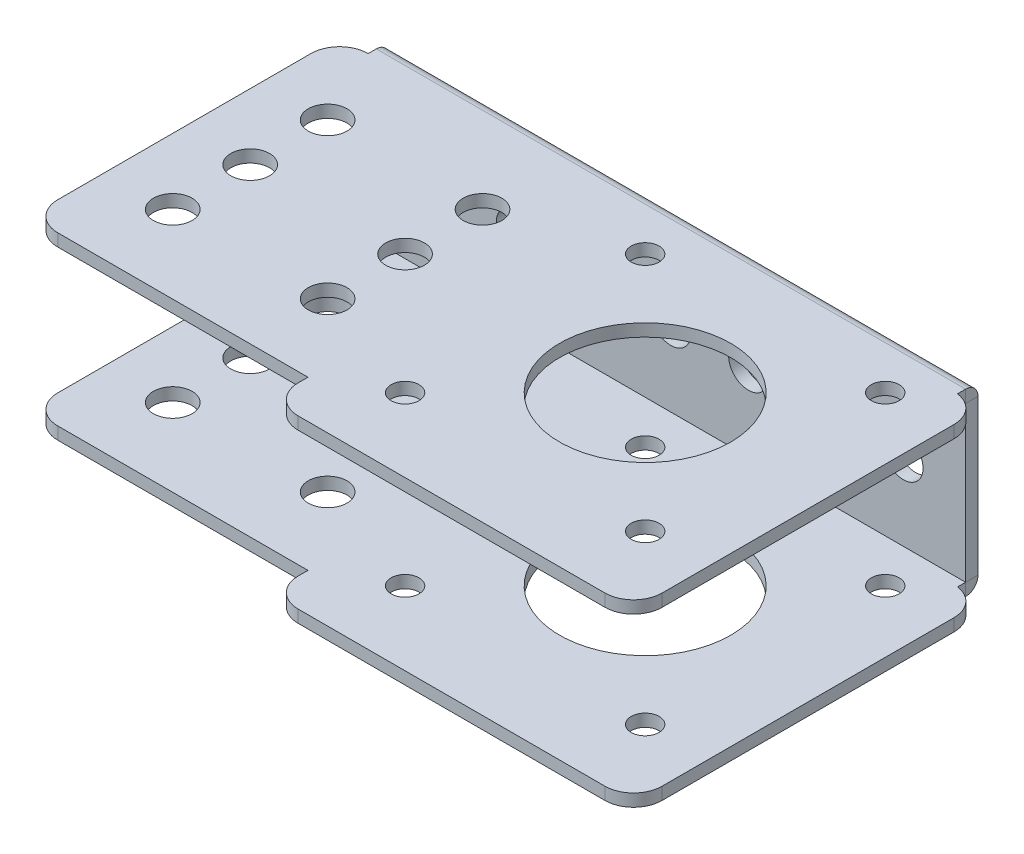
from build123d import *

# Parameters (mm, degrees)
SKETCH1_R                    = 2.5
SKETCH1_R_2                  = 1.8
SKETCH1_R_3                  = 2.55
SKETCH1_R_4                  = 11.05
BOSS_EXTRUDE1_DEPTH          = 1.6
SKETCHED_START               = -26.738102053
SKETCHED_BEND1_OUTLINE_W     = 83
SKETCHED_BEND1_OUTLINE_H     = 1.6
SKETCHED_BEND1_DEPTH         = 45.741537679
SKETCHED_START_2             = 42.203435626
SKETCHED_BEND1_2_OUTLINE_W   = 83
SKETCHED_BEND1_2_OUTLINE_H   = 1.6
SKETCHED_BEND1_2_DEPTH       = 45.741537678
SKETCHED_START_3             = 19.003435626
SKETCHED_BEND1_3_OUTLINE_R   = 2.5
SKETCHED_BEND1_3_OUTLINE_R_2 = 1.8
SKETCHED_BEND1_3_OUTLINE_R_3 = 11.05
SKETCHED_BEND1_3_DEPTH       = 1.6
SKETCHED_START_4             = 40.603435626
SKETCHED_BEND1_4_OUTLINE_R   = 2.5
SKETCHED_BEND1_4_OUTLINE_R_2 = 1.8
SKETCHED_BEND1_4_OUTLINE_R_3 = 11.05
SKETCHED_BEND1_4_DEPTH       = 1.6
SKETCHED_START_5             = -92
SKETCHED_BEND1_5_DEPTH       = 78


with BuildPart() as part:
    # Sketch1 → Boss-Extrude1 (new body)
    with BuildSketch(Plane.XY):
        with BuildLine():
            Line((-91.108168831, 42.903435626), (-91.108168831, 18.303435626))
            ThreePointArc((-91.108168831, 18.303435626), (-93.724463922, 17.219730716), (-94.808168831, 14.603435626))
            Line((-94.808168831, 14.603435626), (-94.808168831, -18.079639731))
            ThreePointArc((-94.808168831, -18.079639731), (-93.724463922, -20.695934821), (-91.108168831, -21.779639731))
            Line((-91.108168831, -21.779639731), (-58.808168831, -21.779639731))
            Line((-58.808168831, -21.779639731), (-58.808168831, -23.038102053))
            ThreePointArc((-58.808168831, -23.038102053), (-57.724463922, -25.654397143), (-55.108168831, -26.738102053))
            Line((-55.108168831, -26.738102053), (-15.508168831, -26.738102053))
            ThreePointArc((-15.508168831, -26.738102053), (-12.891873741, -25.654397143), (-11.808168831, -23.038102053))
            Line((-11.808168831, -23.038102053), (-11.808168831, 14.636324152))
            ThreePointArc((-11.808168831, 14.636324152), (-12.723275427, 17.072380131), (-15.015935712, 18.303435626))
            Line((-15.015935712, 18.303435626), (-15.015935712, 42.903435626))
            ThreePointArc((-15.015935712, 42.903435626), (-12.723275427, 44.13449112), (-11.808168831, 46.570547099))
            Line((-11.808168831, 46.570547099), (-11.808168831, 84.244973304))
            ThreePointArc((-11.808168831, 84.244973304), (-12.891873741, 86.861268394), (-15.508168831, 87.944973304))
            Line((-15.508168831, 87.944973304), (-55.108168831, 87.944973304))
            ThreePointArc((-55.108168831, 87.944973304), (-57.724463922, 86.861268394), (-58.808168831, 84.244973304))
            Line((-58.808168831, 84.244973304), (-58.808168831, 82.986510982))
            Line((-58.808168831, 82.986510982), (-91.108168831, 82.986510982))
            ThreePointArc((-91.108168831, 82.986510982), (-93.724463922, 81.902806072), (-94.808168831, 79.286510982))
            Line((-94.808168831, 79.286510982), (-94.808168831, 46.603435626))
            ThreePointArc((-94.808168831, 46.603435626), (-93.724463922, 43.987140535), (-91.108168831, 42.903435626))
        make_face()
        with Locations((-66.308168831, 72.944973304)):
            Circle(SKETCH1_R, mode=Mode.SUBTRACT)
        with Locations((-50.808168831, 78.444973304)):
            Circle(SKETCH1_R_2, mode=Mode.SUBTRACT)
        with Locations(Location((-19.808168831, 78.444973304, 0), (0, 0, 180))):
            Circle(SKETCH1_R_2, mode=Mode.SUBTRACT)
        with Locations((-19.808168831, 47.444973304)):
            Circle(SKETCH1_R_2, mode=Mode.SUBTRACT)
        with Locations(Location((-50.808168831, 47.444973304, 0), (0, 0, 180))):
            Circle(SKETCH1_R_2, mode=Mode.SUBTRACT)
        with Locations((-86.308168831, 72.944973304)):
            Circle(SKETCH1_R, mode=Mode.SUBTRACT)
        with Locations((-66.308168831, 62.944973304)):
            Circle(SKETCH1_R, mode=Mode.SUBTRACT)
        with Locations((-66.308168831, 52.944973304)):
            Circle(SKETCH1_R, mode=Mode.SUBTRACT)
        with Locations((-86.308168831, 62.944973304)):
            Circle(SKETCH1_R, mode=Mode.SUBTRACT)
        with Locations((-53.062052272, 30.603435626)):
            Circle(SKETCH1_R_3, mode=Mode.SUBTRACT)
        with Locations((-43.062052272, 30.603435626)):
            Circle(SKETCH1_R_3, mode=Mode.SUBTRACT)
        with Locations((-33.062052272, 30.603435626)):
            Circle(SKETCH1_R_3, mode=Mode.SUBTRACT)
        with Locations((-23.062052272, 30.603435626)):
            Circle(SKETCH1_R_3, mode=Mode.SUBTRACT)
        with Locations((-63.062052272, 30.603435626)):
            Circle(SKETCH1_R_3, mode=Mode.SUBTRACT)
        with Locations((-73.062052272, 30.603435626)):
            Circle(SKETCH1_R_3, mode=Mode.SUBTRACT)
        with Locations((-83.062052272, 30.603435626)):
            Circle(SKETCH1_R_3, mode=Mode.SUBTRACT)
        with Locations((-35.308168831, 62.944973304)):
            Circle(SKETCH1_R_4, mode=Mode.SUBTRACT)
        with Locations((-86.308168831, 52.944973304)):
            Circle(SKETCH1_R, mode=Mode.SUBTRACT)
        with Locations(Location((-35.308168831, -1.738102053, 0), (0, 0, 180))):
            Circle(SKETCH1_R_4, mode=Mode.SUBTRACT)
        with Locations((-19.808168831, -17.238102053)):
            Circle(SKETCH1_R_2, mode=Mode.SUBTRACT)
        with Locations(Location((-19.808168831, 13.761897947, 0), (0, 0, 180))):
            Circle(SKETCH1_R_2, mode=Mode.SUBTRACT)
        with Locations((-50.808168831, 13.761897947)):
            Circle(SKETCH1_R_2, mode=Mode.SUBTRACT)
        with Locations(Location((-50.808168831, -17.238102053, 0), (0, 0, 180))):
            Circle(SKETCH1_R_2, mode=Mode.SUBTRACT)
        with Locations(Location((-66.308168831, -11.738102053, 0), (0, 0, 180))):
            Circle(SKETCH1_R, mode=Mode.SUBTRACT)
        with Locations(Location((-66.308168831, -1.738102053, 0), (0, 0, 180))):
            Circle(SKETCH1_R, mode=Mode.SUBTRACT)
        with Locations(Location((-66.308168831, 8.261897947, 0), (0, 0, 180))):
            Circle(SKETCH1_R, mode=Mode.SUBTRACT)
        with Locations(Location((-86.308168831, 8.261897947, 0), (0, 0, 180))):
            Circle(SKETCH1_R, mode=Mode.SUBTRACT)
        with Locations(Location((-86.308168831, -1.738102053, 0), (0, 0, 180))):
            Circle(SKETCH1_R, mode=Mode.SUBTRACT)
        with Locations(Location((-86.308168831, -11.738102053, 0), (0, 0, 180))):
            Circle(SKETCH1_R, mode=Mode.SUBTRACT)
    extrude(amount=BOSS_EXTRUDE1_DEPTH)

    # Sketched Bend1: read off the stored shape, not the designer's step
    # Sketched Bend1 outline → Sketched Bend1 (cut)
    with BuildSketch(Plane(origin=(0, 0, 0), x_dir=(1, 0, 0), z_dir=(0, 1, 0)).offset(SKETCHED_START)):
        with Locations((-53.308168831, -0.8)):
            Rectangle(SKETCHED_BEND1_OUTLINE_W, SKETCHED_BEND1_OUTLINE_H)
    extrude(amount=SKETCHED_BEND1_DEPTH, mode=Mode.SUBTRACT)

    # Sketched Bend1 2 outline → Sketched Bend1 2 (cut)
    with BuildSketch(Plane(origin=(0, 0, 0), x_dir=(1, 0, 0), z_dir=(0, 1, 0)).offset(SKETCHED_START_2)):
        with Locations((-53.308168831, -0.8)):
            Rectangle(SKETCHED_BEND1_2_OUTLINE_W, SKETCHED_BEND1_2_OUTLINE_H)
    extrude(amount=SKETCHED_BEND1_2_DEPTH, mode=Mode.SUBTRACT)

    # Sketched Bend1 3 outline → Sketched Bend1 3 (add)
    with BuildSketch(Plane(origin=(0, 0, 0), x_dir=(1, 0, 0), z_dir=(0, 1, 0)).offset(SKETCHED_START_3)):
        with BuildLine():
            Line((-15.015935712, -2.643362939), (-15.015935712, -1.6))
            Line((-15.015935712, -1.6), (-91.108168831, -1.6))
            Line((-91.108168831, -1.6), (-91.108168831, -2.643362939))
            ThreePointArc((-91.108168831, -2.643362939), (-93.724463922, -3.727067848), (-94.808168831, -6.343362939))
            Line((-94.808168831, -6.343362939), (-94.808168831, -39.026438295))
            ThreePointArc((-94.808168831, -39.026438295), (-93.724463922, -41.642733385), (-91.108168831, -42.726438295))
            Line((-91.108168831, -42.726438295), (-58.808168831, -42.726438295))
            Line((-58.808168831, -42.726438295), (-58.808168831, -43.984900617))
            ThreePointArc((-58.808168831, -43.984900617), (-57.724463922, -46.601195708), (-55.108168831, -47.684900617))
            Line((-55.108168831, -47.684900617), (-15.508168831, -47.684900617))
            ThreePointArc((-15.508168831, -47.684900617), (-12.891873741, -46.601195707), (-11.808168831, -43.984900617))
            Line((-11.808168831, -43.984900617), (-11.808168831, -6.310474412))
            ThreePointArc((-11.808168831, -6.310474412), (-12.723275427, -3.874418433), (-15.015935712, -2.643362939))
        make_face()
        with Locations((-86.308168831, -32.684900617)):
            Circle(SKETCHED_BEND1_3_OUTLINE_R, mode=Mode.SUBTRACT)
        with Locations((-66.308168831, -32.684900617)):
            Circle(SKETCHED_BEND1_3_OUTLINE_R, mode=Mode.SUBTRACT)
        with Locations((-50.808168831, -38.184900617)):
            Circle(SKETCHED_BEND1_3_OUTLINE_R_2, mode=Mode.SUBTRACT)
        with Locations((-19.808168831, -38.184900617)):
            Circle(SKETCHED_BEND1_3_OUTLINE_R_2, mode=Mode.SUBTRACT)
        with Locations((-86.308168831, -22.684900617)):
            Circle(SKETCHED_BEND1_3_OUTLINE_R, mode=Mode.SUBTRACT)
        with Locations((-86.308168831, -12.684900617)):
            Circle(SKETCHED_BEND1_3_OUTLINE_R, mode=Mode.SUBTRACT)
        with Locations((-66.308168831, -22.684900617)):
            Circle(SKETCHED_BEND1_3_OUTLINE_R, mode=Mode.SUBTRACT)
        with Locations((-66.308168831, -12.684900617)):
            Circle(SKETCHED_BEND1_3_OUTLINE_R, mode=Mode.SUBTRACT)
        with Locations((-35.308168831, -22.684900617)):
            Circle(SKETCHED_BEND1_3_OUTLINE_R_3, mode=Mode.SUBTRACT)
        with Locations((-50.808168831, -7.184900617)):
            Circle(SKETCHED_BEND1_3_OUTLINE_R_2, mode=Mode.SUBTRACT)
        with Locations((-19.808168831, -7.184900617)):
            Circle(SKETCHED_BEND1_3_OUTLINE_R_2, mode=Mode.SUBTRACT)
    extrude(amount=SKETCHED_BEND1_3_DEPTH)

    # Sketched Bend1 4 outline → Sketched Bend1 4 (add)
    with BuildSketch(Plane(origin=(0, 0, 0), x_dir=(1, 0, 0), z_dir=(0, 1, 0)).offset(SKETCHED_START_4)):
        with BuildLine():
            Line((-15.015935712, -2.643362939), (-15.015935712, -1.6))
            Line((-15.015935712, -1.6), (-91.108168831, -1.6))
            Line((-91.108168831, -1.6), (-91.108168831, -2.643362939))
            ThreePointArc((-91.108168831, -2.643362939), (-93.724463922, -3.727067848), (-94.808168831, -6.343362939))
            Line((-94.808168831, -6.343362939), (-94.808168831, -39.026438295))
            ThreePointArc((-94.808168831, -39.026438295), (-93.724463922, -41.642733385), (-91.108168831, -42.726438295))
            Line((-91.108168831, -42.726438295), (-58.808168831, -42.726438295))
            Line((-58.808168831, -42.726438295), (-58.808168831, -43.984900617))
            ThreePointArc((-58.808168831, -43.984900617), (-57.724463922, -46.601195708), (-55.108168831, -47.684900617))
            Line((-55.108168831, -47.684900617), (-15.508168831, -47.684900617))
            ThreePointArc((-15.508168831, -47.684900617), (-12.891873741, -46.601195707), (-11.808168831, -43.984900617))
            Line((-11.808168831, -43.984900617), (-11.808168831, -6.310474412))
            ThreePointArc((-11.808168831, -6.310474412), (-12.723275427, -3.874418433), (-15.015935712, -2.643362939))
        make_face()
        with Locations((-86.308168831, -32.684900617)):
            Circle(SKETCHED_BEND1_4_OUTLINE_R, mode=Mode.SUBTRACT)
        with Locations((-66.308168831, -32.684900617)):
            Circle(SKETCHED_BEND1_4_OUTLINE_R, mode=Mode.SUBTRACT)
        with Locations((-50.808168831, -38.184900617)):
            Circle(SKETCHED_BEND1_4_OUTLINE_R_2, mode=Mode.SUBTRACT)
        with Locations((-19.808168831, -38.184900617)):
            Circle(SKETCHED_BEND1_4_OUTLINE_R_2, mode=Mode.SUBTRACT)
        with Locations((-86.308168831, -22.684900617)):
            Circle(SKETCHED_BEND1_4_OUTLINE_R, mode=Mode.SUBTRACT)
        with Locations((-86.308168831, -12.684900617)):
            Circle(SKETCHED_BEND1_4_OUTLINE_R, mode=Mode.SUBTRACT)
        with Locations((-66.308168831, -22.684900617)):
            Circle(SKETCHED_BEND1_4_OUTLINE_R, mode=Mode.SUBTRACT)
        with Locations((-66.308168831, -12.684900617)):
            Circle(SKETCHED_BEND1_4_OUTLINE_R, mode=Mode.SUBTRACT)
        with Locations((-35.308168831, -22.684900617)):
            Circle(SKETCHED_BEND1_4_OUTLINE_R_3, mode=Mode.SUBTRACT)
        with Locations((-50.808168831, -7.184900617)):
            Circle(SKETCHED_BEND1_4_OUTLINE_R_2, mode=Mode.SUBTRACT)
        with Locations((-19.808168831, -7.184900617)):
            Circle(SKETCHED_BEND1_4_OUTLINE_R_2, mode=Mode.SUBTRACT)
    extrude(amount=SKETCHED_BEND1_4_DEPTH)

    # Sketched Bend1 5 outline → Sketched Bend1 5 (cut)
    with BuildSketch(Plane.YZ.offset(SKETCHED_START_5)):
        with BuildLine():
            Line((42.203435626, 0), (42.203435626, 1.6))
            ThreePointArc((42.203435626, 1.6), (41.734806476, 0.46862915), (40.603435626, 0))
            Line((40.603435626, 0), (42.203435626, 0))
        make_face()
        with BuildLine():
            Line((19.003435626, 0), (20.603435626, 0))
            ThreePointArc((20.603435626, 0), (19.472064776, 0.46862915), (19.003435626, 1.6))
            Line((19.003435626, 1.6), (19.003435626, 0))
        make_face()
    extrude(amount=SKETCHED_BEND1_5_DEPTH, mode=Mode.SUBTRACT)


solid = part.part
